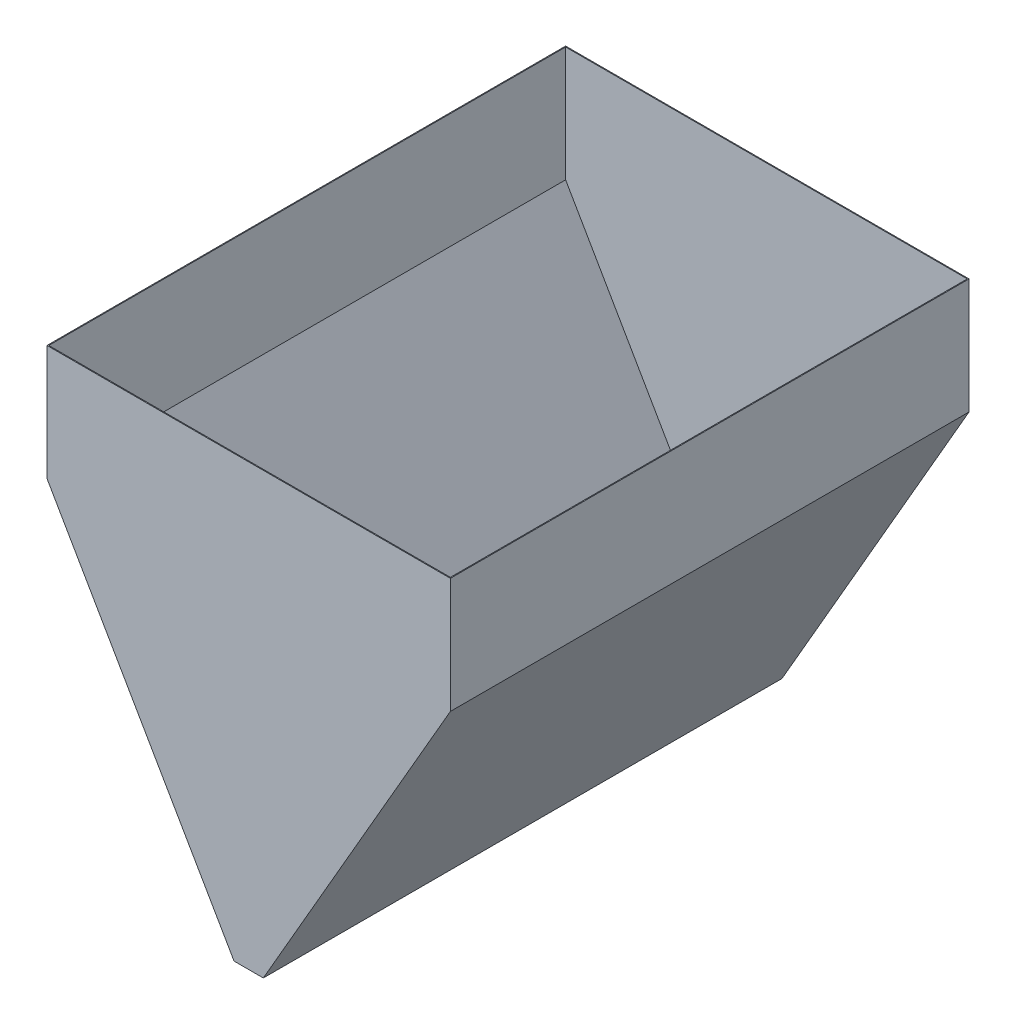
from build123d import *

# Parameters (mm, degrees)
CROQUIS3_W              = 350
CROQUIS3_H              = 450
SALIENTE_EXTRUIR1_DEPTH = 100
VACIADO2_T              = -0.76


with BuildPart() as part:
    # Croquis1 → Recubrir1 section 0
    with BuildSketch(Plane(origin=(0, 0, 0), x_dir=(1, 0, 0), z_dir=(0, 1, 0))):
        with BuildLine():
            Line((-175, 225), (175, 225))
            Line((175, 225), (175, -225))
            Line((175, -225), (-175, -225))
            Line((-175, -225), (-175, 225))
        make_face()
    # Croquis2 → Recubrir1 section 1
    with BuildSketch(Plane(origin=(0, -281.458, 0), x_dir=(1, 0, 0), z_dir=(0, 1, 0))):
        with BuildLine():
            Line((-12.7, 225), (12.7, 225))
            Line((12.7, 225), (12.7, -225))
            Line((12.7, -225), (-12.7, -225))
            Line((-12.7, -225), (-12.7, 225))
        make_face()
    loft()

    # Croquis3 → Saliente-Extruir1 (add)
    with BuildSketch(Plane(origin=(0, 0, 0), x_dir=(1, 0, 0), z_dir=(0, 1, 0))):
        Rectangle(CROQUIS3_W, CROQUIS3_H)
    extrude(amount=SALIENTE_EXTRUIR1_DEPTH)

    # Vaciado2
    vaciado2_openings = [part.faces().sort_by_distance(p)[0] for p in [
        (0, -281.458, 0),
        (0, 100, 0),
    ]]
    offset(amount=VACIADO2_T, openings=vaciado2_openings, kind=Kind.INTERSECTION)


solid = part.part
